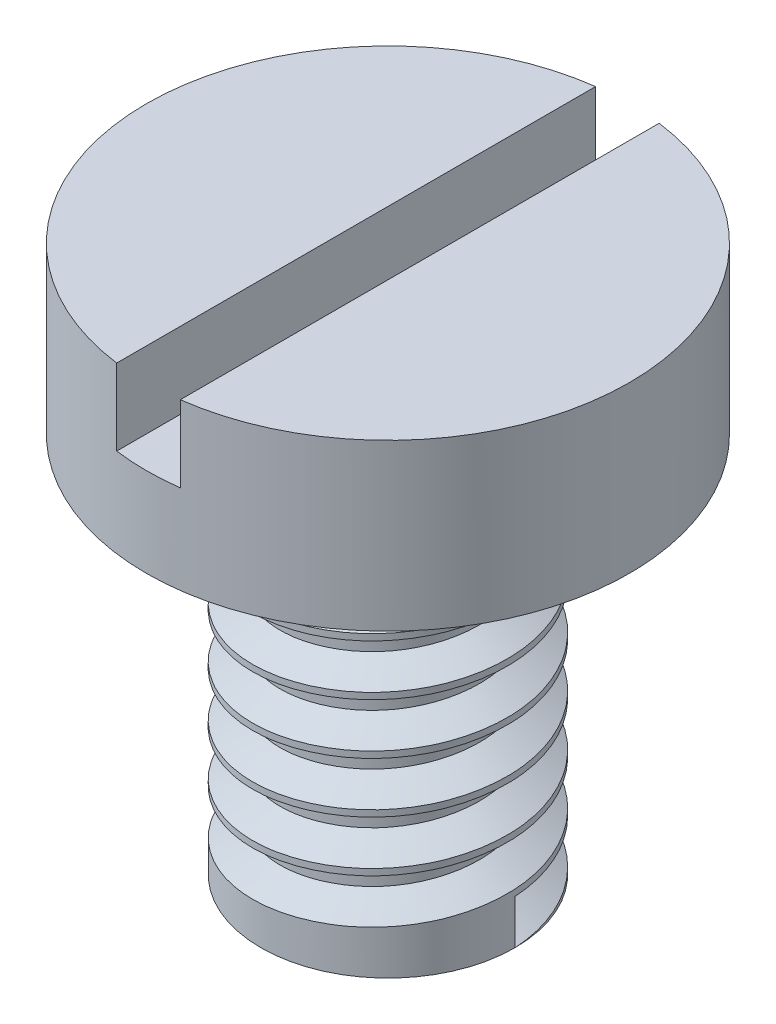
from build123d import *

# Parameters (mm, degrees)
SKETCH1_R           = 1.9
BOSS_EXTRUDE1_DEPTH = 1.3
SKETCH2_R           = 1
BOSS_EXTRUDE2_DEPTH = 3
THREAD1_PITCH       = 0.4
SKETCH6_W           = 0.5
SKETCH6_H           = 4
CUT_EXTRUDE1_DEPTH  = 0.6


with BuildPart() as part:
    # Sketch1 → Boss-Extrude1 (new body)
    with BuildSketch(Plane(origin=(0, 0, 0), x_dir=(1, 0, 0), z_dir=(0, 1, 0))):
        with Locations(Location((0, 0, 0), (0, 0, 270))):
            Circle(SKETCH1_R)
    extrude(amount=BOSS_EXTRUDE1_DEPTH)

    # Sketch2 → Boss-Extrude2 (add)
    with BuildSketch(Plane.XZ):
        with Locations(Location((0, 0, 0), (0, 0, 270))):
            Circle(SKETCH2_R)
    extrude(amount=BOSS_EXTRUDE2_DEPTH)

    # Thread1: the profile of Thread Profile1 profile screwed along a right-hand helix of 7.5 turns, 6 arcs to a turn; built about Z, then put on its axis
    thread1_z = Axis((0, 0, 0), (0, 0, 1))
    thread1_corners = [(1.0003, 0, -0.000173205), (1.0003, 0, 0.350173204), (0.78349365, 0, 0.224999999), (0.78349365, 0, 0.124999999)]
    with BuildLine(mode=Mode.PRIVATE) as thread1_profile:
        Line(thread1_corners[0], thread1_corners[1])
        Line(thread1_corners[1], thread1_corners[2])
        Line(thread1_corners[2], thread1_corners[3])
        Line(thread1_corners[3], thread1_corners[0])
    thread1_cap = Face(thread1_profile.wire())
    thread1_turn_angles = [0, 30, 60, 90, 120, 150, 180, 210, 240, 270, 300, 330, 360]
    thread1_turn_weights = [1, 0.8660254037844387, 1, 0.8660254037844387, 1, 0.8660254037844387, 1, 0.8660254037844387, 1, 0.8660254037844387, 1, 0.8660254037844387, 1]
    thread1_turn_rails = [Edge.make_bspline([Vector(p[0], p[1], 0).rotate(thread1_z, thread1_turn_angles[k]) / thread1_turn_weights[k] + Vector(0, 0, p[2] + THREAD1_PITCH * thread1_turn_angles[k] / 360) for k in range(13)], [0, 0, 0, 1, 1, 2, 2, 3, 3, 4, 4, 5, 5, 6, 6, 6], 2, thread1_turn_weights) for p in thread1_corners]
    thread1_turn_sides = [Face.make_surface_from_curves(thread1_turn_rails[p[0]], thread1_turn_rails[p[1]]) for p in [(0, 1), (1, 2), (2, 3), (3, 0)]]
    thread1_last_angles = [2520, 2550, 2580, 2610, 2640, 2670, 2700]
    thread1_last_weights = [1, 0.8660254037844387, 1, 0.8660254037844387, 1, 0.8660254037844387, 1]
    thread1_last_rails = [Edge.make_bspline([Vector(p[0], p[1], 0).rotate(thread1_z, thread1_last_angles[k]) / thread1_last_weights[k] + Vector(0, 0, p[2] + THREAD1_PITCH * thread1_last_angles[k] / 360) for k in range(7)], [0, 0, 0, 1, 1, 2, 2, 3, 3, 3], 2, thread1_last_weights) for p in thread1_corners]
    thread1_last_sides = [Face.make_surface_from_curves(thread1_last_rails[p[0]], thread1_last_rails[p[1]]) for p in [(0, 1), (1, 2), (2, 3), (3, 0)]]
    thread1 = Plane(origin=(0, -3, 0), x_dir=(1, 0, 0), z_dir=(0, 1, 0)) * Solid(Shell([*[p.moved(Location((0, 0, THREAD1_PITCH * i))) for i in range(7) for p in thread1_turn_sides], *thread1_last_sides, thread1_cap, thread1_cap.rotate(thread1_z, 2700).moved(Location((0, 0, THREAD1_PITCH * 2700 / 360)))]))
    add(thread1, mode=Mode.SUBTRACT)

    # Sketch6 → Cut-Extrude1 (cut)
    with BuildSketch(Plane(origin=(0, 1.3, 0), x_dir=(1, 0, 0), z_dir=(0, 1, 0))):
        Rectangle(SKETCH6_W, SKETCH6_H)
    extrude(amount=-CUT_EXTRUDE1_DEPTH, mode=Mode.SUBTRACT)


solid = part.part
